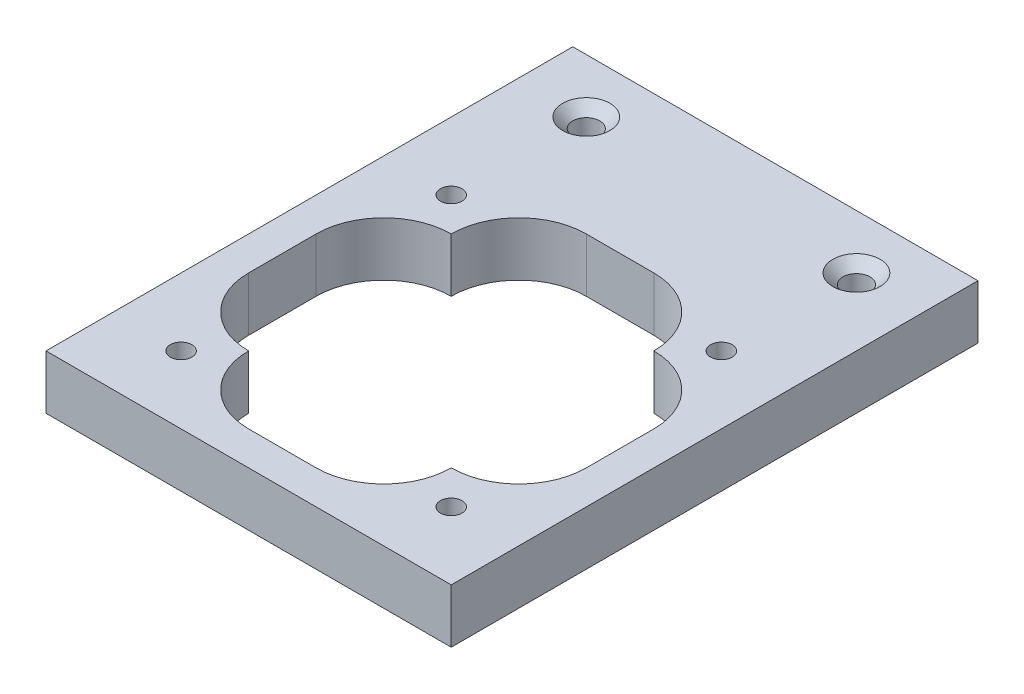
from build123d import *

# Parameters (mm, degrees)
AUFSATZ_LINEAR_AUSTRAGEN1_DEPTH                      = 4
VERRUNDUNG1_R                                        = 5
FORMSENKUNG_F_R_M3_SENKSCHRAUBE_MIT_INNE_D           = 2
FORMSENKUNG_F_R_M3_SENKSCHRAUBE_MIT_INNE_CSINK_D     = 3.5
FORMSENKUNG_F_R_M3_SENKSCHRAUBE_MIT_INNE_CSINK_ANGLE = 90
M2_GEWINDEBOHRUNG1_D                                 = 1.6


with BuildPart() as part:
    # Skizze1 → Aufsatz-Linear austragen1 (new body)
    with BuildSketch(Plane(origin=(0, 0, 0), x_dir=(1, 0, 0), z_dir=(0, 1, 0))):
        Polygon((-15, 15), (-15, -15), (15, -15), (15, 15), (15, 24), (-15, 24), align=None)
        Polygon((-12.5, 7.5), (-7.5, 7.5), (-7.5, 12.5), (7.5, 12.5), (7.5, 7.5), (12.5, 7.5), (12.5, -7.5), (7.5, -7.5), (7.5, -12.5), (-7.5, -12.5), (-7.5, -7.5), (-12.5, -7.5), align=None, mode=Mode.SUBTRACT)
    extrude(amount=AUFSATZ_LINEAR_AUSTRAGEN1_DEPTH)

    # Verrundung1
    verrundung1_edges = [part.edges().sort_by_distance(p)[0] for p in [
        (-7.5, 2, 12.5),
        (-12.5, 2, 7.5),
        (12.5, 2, 7.5),
        (7.5, 2, 12.5),
        (12.5, 2, -7.5),
        (7.5, 2, -12.5),
        (-7.5, 2, -12.5),
        (-12.5, 2, -7.5),
    ]]
    fillet(verrundung1_edges, radius=VERRUNDUNG1_R - 0.0001)  # a hair under: the kernel refuses the full size

    # Formsenkung für M3 Senkschraube mit Innensechskant1 (through all)
    with Locations(Plane(origin=(0, 4, 0), x_dir=(1, 0, 0), z_dir=(0, 1, 0))):
        with Locations((-10, 20), (10, 20)):
            CounterSinkHole(FORMSENKUNG_F_R_M3_SENKSCHRAUBE_MIT_INNE_D / 2, FORMSENKUNG_F_R_M3_SENKSCHRAUBE_MIT_INNE_CSINK_D / 2, counter_sink_angle=FORMSENKUNG_F_R_M3_SENKSCHRAUBE_MIT_INNE_CSINK_ANGLE)

    # M2 Gewindebohrung1 (through all)
    with Locations(Plane(origin=(0, 4, 0), x_dir=(1, 0, 0), z_dir=(0, 1, 0))):
        with Locations((-10, 10), (10, 10), (10, -10), (-10, -10)):
            Hole(M2_GEWINDEBOHRUNG1_D / 2)


solid = part.part
